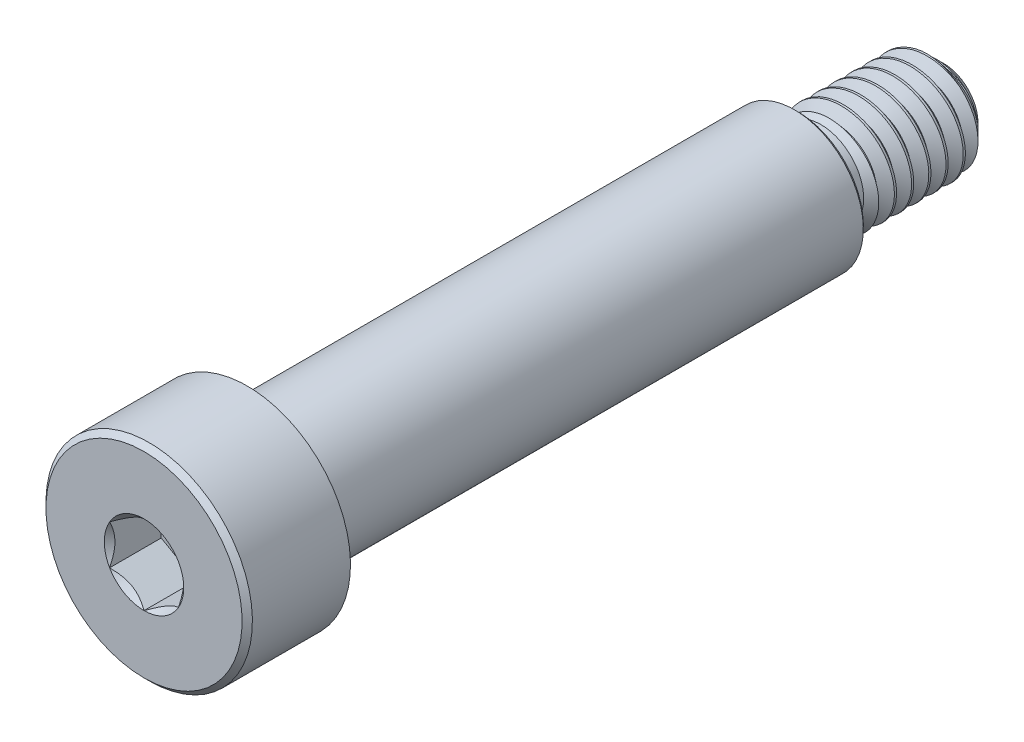
from build123d import *
from build123d.topology import SkipClean

# Parameters (mm, degrees)
CUT_REVOLVE_THIN1_START         = -7.379
CUT_REVOLVE_THIN1_OUTLINE_R     = 2
CUT_REVOLVE_THIN1_OUTLINE_R_2   = 1.807
CUT_REVOLVE_THIN1_DEPTH         = 15.873
CUT_REVOLVE_THIN1_2_OUTLINE_R   = 2
CUT_REVOLVE_THIN1_2_OUTLINE_R_2 = 1.797
CUT_REVOLVE_THIN1_2_DEPTH       = 15.873
CUT_EXTRUDE1_START              = 11.621
CUT_EXTRUDE1_DEPTH              = 1.5
CHAMFER1_SIZE                   = 0.0975
CHAMFER2_SIZE                   = 0.506148016
CUT_SWEEP1_PITCH                = 0.5
CUT_SWEEP1_TO                   = 3.567136


with BuildPart() as part:
    # Sketch3 → Revolve1 (revolve)
    with BuildSketch(Plane(origin=(0, 0, 0), x_dir=(0, 0, -1), z_dir=(1, 0, 0)), mode=Mode.PRIVATE) as revolve1_sk:
        with BuildLine():
            Line((-11.621, 0), (-11.621, 2.805))
            Line((-11.621, 2.805), (-11.621, 3))
            Line((-11.621, 3), (-8.816, 3))
            Line((-8.816, 3), (-8.621, 3))
            Line((-8.621, 3), (-8.621, 1.797))
            Line((-8.621, 1.797), (-8.494, 1.797))
            Line((-8.494, 1.797), (-8.494, 2))
            Line((-8.494, 2), (7.379, 2))
            Line((7.379, 2), (7.379, 1.36904775))
            ThreePointArc((7.379, 1.36904775), (7.417355026, 1.276450526), (7.50995225, 1.2380955))
            Line((7.50995225, 1.2380955), (8.053864022, 1.2380955))
            Line((8.053864022, 1.2380955), (8.053864022, 1.5))
            Line((8.053864022, 1.5), (11.246, 1.5))
            Line((11.246, 1.5), (11.621, 1.5))
            Line((11.621, 1.5), (11.621, 0))
            Line((11.621, 0), (-11.621, 0))
        make_face()
    revolve(revolve1_sk.sketch.rotate(Axis((0, 0, 11.621), (0, 0, -1)), 180), axis=Axis((0, 0, 11.621), (0, 0, -1)))

    # Cut-Revolve-Thin1 2 outline → Cut-Revolve-Thin1 2 (cut)
    with SkipClean():  # the faces are left unmerged after this step: merging them gives an invalid solid
        with BuildSketch(Plane.XY.offset(CUT_REVOLVE_THIN1_START)):
            Circle(CUT_REVOLVE_THIN1_2_OUTLINE_R)
            Circle(CUT_REVOLVE_THIN1_2_OUTLINE_R_2, mode=Mode.SUBTRACT)
        extrude(amount=CUT_REVOLVE_THIN1_2_DEPTH, mode=Mode.SUBTRACT)

    # Sketch4 → Cut-Extrude1 (cut)
    with SkipClean():  # the faces are left unmerged after this step: merging them gives an invalid solid
        with BuildSketch(Plane.XY.offset(CUT_EXTRUDE1_START)):
            Polygon((0, 1.154700538), (-1, 0.577350269), (-1, -0.577350269), (0, -1.154700538), (1, -0.577350269), (1, 0.577350269), align=None)
        extrude(amount=-CUT_EXTRUDE1_DEPTH, mode=Mode.SUBTRACT)

    # Cut-Extrude2 cone 1 section (through the dimple's axis) → Cut-Extrude2 (revolve, cut)
    with SkipClean():  # the faces are left unmerged after this step: merging them gives an invalid solid
        with BuildSketch(Plane(origin=(0, 0, 11.621), x_dir=(0, -1, 0), z_dir=(1, 0, 0))):
            Polygon((0, 0), (1.154700538, 0), (0, 1.154700538), align=None)
        revolve(axis=Axis((0, 0, 11.621), (0, 0, -1)), mode=Mode.SUBTRACT)

    # Chamfer2
    chamfer2_edges = [part.edges().sort_by_distance(p)[0] for p in [
        (0, 1.5, -11.621),
    ]]
    chamfer(chamfer2_edges, length=CHAMFER2_SIZE)

    # Sketch10 → Cut-Revolve2 (revolve, cut)
    with SkipClean():  # the faces are left unmerged after this step: merging them gives an invalid solid
        with BuildSketch(Plane(origin=(0, 0, 0), x_dir=(0, 0, -1), z_dir=(1, 0, 0)), mode=Mode.PRIVATE) as cut_revolve2_sk:
            Polygon((-11.621, 2.85), (-11.471, 3), (-11.621, 3), align=None)
        revolve(cut_revolve2_sk.sketch.rotate(Axis((0, 0, 11.621), (0, 0, -1)), 180), axis=Axis((0, 0, 11.621), (0, 0, -1)), mode=Mode.SUBTRACT)


with BuildPart() as body_2:
    # Cut-Revolve-Thin1: read off the stored shape, not the designer's step
    # Cut-Revolve-Thin1 outline → Cut-Revolve-Thin1 (new body)
    with BuildSketch(Plane.XY.offset(CUT_REVOLVE_THIN1_START)):
        Circle(CUT_REVOLVE_THIN1_OUTLINE_R)
        Circle(CUT_REVOLVE_THIN1_OUTLINE_R_2, mode=Mode.SUBTRACT)
    extrude(amount=CUT_REVOLVE_THIN1_DEPTH)

    # Chamfer1
    chamfer1_edges = [body_2.edges().sort_by_distance(p)[0] for p in [
        (-2, 0, -7.379),
    ]]
    chamfer(chamfer1_edges, length=CHAMFER1_SIZE)


with BuildPart() as body_3:
    # Split1: read off the stored shape, not the designer's step
    # Split1: the piece on the far side of the plane
    add(part.part)
    split(bisect_by=Plane.XY.offset(-8.053864022), keep=Keep.BOTTOM)

    # Cut-Sweep1: arcs per turn and ends read off the stored shape
    # Cut-Sweep1: the profile of Sketch7 screwed along a right-hand helix through 9 turns, 6 arcs to a turn; built about Z, then put on its axis
    cut_sweep1_z = Axis((0, 0, 0), (0, 0, 1))
    cut_sweep1_corners = [(1.527063294, 0, 0.015625), (1.175240474, 0, -0.1875), (1.175240474, 0, -0.25), (1.527063294, 0, -0.453125)]
    with BuildLine(mode=Mode.PRIVATE) as cut_sweep1_profile:
        Line(cut_sweep1_corners[0], cut_sweep1_corners[1])
        Line(cut_sweep1_corners[1], cut_sweep1_corners[2])
        Line(cut_sweep1_corners[2], cut_sweep1_corners[3])
        Line(cut_sweep1_corners[3], cut_sweep1_corners[0])
    cut_sweep1_cap = Face(cut_sweep1_profile.wire())
    cut_sweep1_turn_angles = [0, 30, 60, 90, 120, 150, 180, 210, 240, 270, 300, 330, 360]
    cut_sweep1_turn_weights = [1, 0.8660254037844387, 1, 0.8660254037844387, 1, 0.8660254037844387, 1, 0.8660254037844387, 1, 0.8660254037844387, 1, 0.8660254037844387, 1]
    cut_sweep1_turn_rails = [Edge.make_bspline([Vector(p[0], p[1], 0).rotate(cut_sweep1_z, cut_sweep1_turn_angles[k]) / cut_sweep1_turn_weights[k] + Vector(0, 0, p[2] + CUT_SWEEP1_PITCH * cut_sweep1_turn_angles[k] / 360) for k in range(13)], [0, 0, 0, 1, 1, 2, 2, 3, 3, 4, 4, 5, 5, 6, 6, 6], 2, cut_sweep1_turn_weights) for p in cut_sweep1_corners]
    cut_sweep1_turn_sides = [Face.make_surface_from_curves(cut_sweep1_turn_rails[p[0]], cut_sweep1_turn_rails[p[1]]) for p in [(0, 1), (1, 2), (2, 3), (3, 0)]]
    cut_sweep1 = Plane(origin=(0, 0, -11.621), x_dir=(0, 1, 0), z_dir=(0, 0, 1)) * split(Solid(Shell([*[p.moved(Location((0, 0, CUT_SWEEP1_PITCH * i))) for i in range(9) for p in cut_sweep1_turn_sides], cut_sweep1_cap, cut_sweep1_cap.rotate(cut_sweep1_z, 3240).moved(Location((0, 0, CUT_SWEEP1_PITCH * 3240 / 360)))])), bisect_by=Plane.XY.offset(CUT_SWEEP1_TO), keep=Keep.BOTTOM, mode=Mode.PRIVATE)
    add(cut_sweep1, mode=Mode.SUBTRACT)

    # Sketch11 → Cut-Revolve3 (revolve, cut)
    with BuildSketch(Plane(origin=(0, 0, 0), x_dir=(0, 0, -1), z_dir=(1, 0, 0)), mode=Mode.PRIVATE) as cut_revolve3_sk:
        with BuildLine():
            Line((8.053864022, 1.2380955), (7.50995225, 1.2380955))
            ThreePointArc((7.50995225, 1.2380955), (7.417355026, 1.276450526), (7.379, 1.36904775))
            Line((7.379, 1.36904775), (7.379, 1.5))
            Line((7.379, 1.5), (8.315768522, 1.5))
            Line((8.315768522, 1.5), (8.053864022, 1.2380955))
        make_face()
    revolve(cut_revolve3_sk.sketch.rotate(Axis((0, 0, 11.621), (0, 0, -1)), 180), axis=Axis((0, 0, 11.621), (0, 0, -1)), mode=Mode.SUBTRACT)


with BuildPart() as part_1:
    add(part.part)

    # Split1
    split(bisect_by=Plane.XY.offset(-8.053864022), keep=Keep.TOP)


with BuildPart() as body_3_1:
    add(body_3.part)

    # Combine1: union part
    add(part_1.part)


solid = Compound([body_2.part, body_3_1.part])
